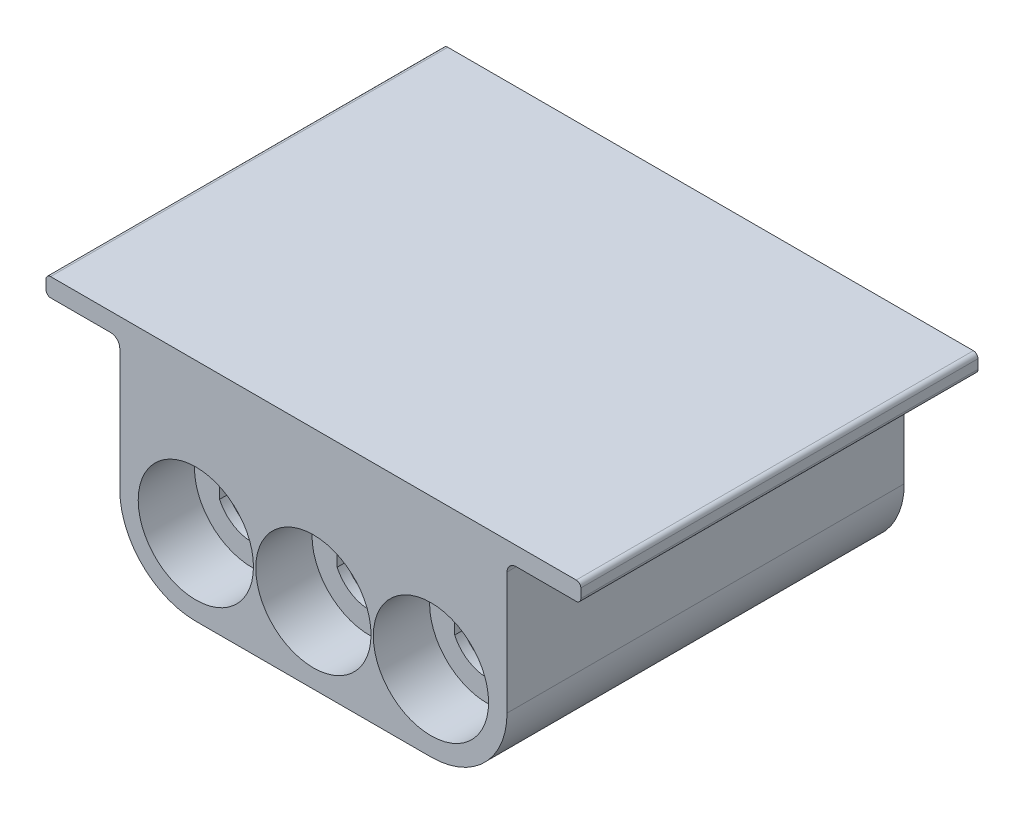
from build123d import *
from build123d.topology import SkipClean

# Parameters (mm, degrees)
SKETCH1_R            = 12.5
BOSS_EXTRUDE1_DEPTH  = 1.2
BOSS_EXTRUDE2_START  = 11
SKETCH2_R            = 12.5
BOSS_EXTRUDE2_DEPTH  = 11
BOSS_EXTRUDE3_START  = 2
BOSS_EXTRUDE3_DEPTH  = 2
SKETCH4_R            = 12
BOSS_EXTRUDE4_DEPTH  = 5.3
BOSS_EXTRUDE5_DEPTH  = 84.455
BOSS_EXTRUDE6_DEPTH  = 0.5
BOSS_EXTRUDE7_DEPTH  = 84
FILLET1_R            = 1
FILLET2_R            = 1
BOSS_EXTRUDE8_DEPTH  = 10
CHAMFER2_SIZE        = 4
SKETCH11_R           = 1.25
CUT_EXTRUDE1_DEPTH   = 20
BOSS_EXTRUDE10_DEPTH = 86.155


with BuildPart() as part:
    # Sketch1 → Boss-Extrude1 (new body)
    with BuildSketch(Plane.XY):
        with BuildLine():
            Line((-163.58008547, 21.295659048), (-163.58008547, 37.295659048))
            ThreePointArc((-163.58008547, 37.295659048), (-158.747347359, 48.962920938), (-147.08008547, 53.795659048))
            Line((-147.08008547, 53.795659048), (-96.08008547, 53.795659048))
            ThreePointArc((-96.08008547, 53.795659048), (-84.41282358, 48.962920938), (-79.58008547, 37.295659048))
            Line((-79.58008547, 37.295659048), (-79.58008547, 21.295659048))
            ThreePointArc((-79.58008547, 21.295659048), (-84.41282358, 9.628397159), (-96.08008547, 4.795659048))
            Line((-96.08008547, 4.795659048), (-147.08008547, 4.795659048))
            ThreePointArc((-147.08008547, 4.795659048), (-158.747347359, 9.628397159), (-163.58008547, 21.295659048))
        make_face()
        with Locations((-147.08008547, 21.295659048)):
            Circle(SKETCH1_R, mode=Mode.SUBTRACT)
        with Locations((-121.58008547, 21.295659048)):
            Circle(SKETCH1_R, mode=Mode.SUBTRACT)
        with Locations((-96.08008547, 21.295659048)):
            Circle(SKETCH1_R, mode=Mode.SUBTRACT)
    extrude(amount=BOSS_EXTRUDE1_DEPTH)

    # Sketch2 → Boss-Extrude2 (add)
    with SkipClean():  # the faces are left unmerged after this step: merging them gives an invalid solid
        with BuildSketch(Plane(origin=(0, 0, 0), x_dir=(-1, 0, 0), z_dir=(0, 0, -1)).offset(BOSS_EXTRUDE2_START)):
            with BuildLine():
                ThreePointArc((135.218587212, 15.169701239), (160.43008547, 21.295659048), (135.218587212, 27.421616857))
                ThreePointArc((135.218587212, 27.421616857), (134.33008547, 26.880490101), (133.441583727, 27.421616857))
                ThreePointArc((133.441583727, 27.421616857), (121.58008547, 34.645659048), (109.718587212, 27.421616857))
                ThreePointArc((109.718587212, 27.421616857), (108.83008547, 26.880490101), (107.941583727, 27.421616857))
                ThreePointArc((107.941583727, 27.421616857), (82.73008547, 21.295659048), (107.941583727, 15.169701239))
                ThreePointArc((107.941583727, 15.169701239), (108.83008547, 15.710827995), (109.718587212, 15.169701239))
                ThreePointArc((109.718587212, 15.169701239), (121.58008547, 7.945659048), (133.441583727, 15.169701239))
                ThreePointArc((133.441583727, 15.169701239), (134.33008547, 15.710827995), (135.218587212, 15.169701239))
            make_face()
            with Locations((96.08008547, 21.295659048)):
                Circle(SKETCH2_R, mode=Mode.SUBTRACT)
            with Locations((121.58008547, 21.295659048)):
                Circle(SKETCH2_R, mode=Mode.SUBTRACT)
            with Locations((147.08008547, 21.295659048)):
                Circle(SKETCH2_R, mode=Mode.SUBTRACT)
        extrude(amount=-BOSS_EXTRUDE2_DEPTH)

    # Sketch3 → Boss-Extrude3 (add)
    # profile 1 of 4: a face of its own
    with SkipClean():  # the faces are left unmerged after this step: merging them gives an invalid solid
        with BuildSketch(Plane(origin=(0, 0, -11), x_dir=(-1, 0, 0), z_dir=(0, 0, -1)).offset(BOSS_EXTRUDE3_START)):
            with BuildLine():
                ThreePointArc((107.941583727, 27.421616857), (82.73008547, 21.295659048), (107.941583727, 15.169701239))
                ThreePointArc((107.941583727, 15.169701239), (108.83008547, 15.710827995), (109.718587212, 15.169701239))
                ThreePointArc((109.718587212, 15.169701239), (121.58008547, 7.945659048), (133.441583727, 15.169701239))
                ThreePointArc((133.441583727, 15.169701239), (134.33008547, 15.710827995), (135.218587212, 15.169701239))
                ThreePointArc((135.218587212, 15.169701239), (160.43008547, 21.295659048), (135.218587212, 27.421616857))
                ThreePointArc((135.218587212, 27.421616857), (134.33008547, 26.880490101), (133.441583727, 27.421616857))
                ThreePointArc((133.441583727, 27.421616857), (121.58008547, 34.645659048), (109.718587212, 27.421616857))
                ThreePointArc((109.718587212, 27.421616857), (108.83008547, 26.880490101), (107.941583727, 27.421616857))
            make_face()
            with BuildLine():
                Line((128.63008547, 18.07696366), (128.63008547, 24.514354436))
                ThreePointArc((128.63008547, 24.514354436), (121.58008547, 29.045659048), (114.53008547, 24.514354436))
                Line((114.53008547, 24.514354436), (114.53008547, 18.07696366))
                ThreePointArc((114.53008547, 18.07696366), (121.58008547, 13.545659048), (128.63008547, 18.07696366))
            make_face(mode=Mode.SUBTRACT)
            with BuildLine():
                Line((103.13008547, 18.07696366), (103.13008547, 24.514354436))
                ThreePointArc((103.13008547, 24.514354436), (96.08008547, 29.045659048), (89.03008547, 24.514354436))
                Line((89.03008547, 24.514354436), (89.03008547, 18.07696366))
                ThreePointArc((89.03008547, 18.07696366), (96.08008547, 13.545659048), (103.13008547, 18.07696366))
            make_face(mode=Mode.SUBTRACT)
            with BuildLine():
                Line((154.13008547, 24.514354436), (154.13008547, 18.07696366))
                ThreePointArc((154.13008547, 18.07696366), (147.08008547, 13.545659048), (140.03008547, 18.07696366))
                Line((140.03008547, 18.07696366), (140.03008547, 24.514354436))
                ThreePointArc((140.03008547, 24.514354436), (147.08008547, 29.045659048), (154.13008547, 24.514354436))
            make_face(mode=Mode.SUBTRACT)
        # profile 2 of 4: a face of its own
        with BuildSketch(Plane(origin=(0, 0, -11), x_dir=(-1, 0, 0), z_dir=(0, 0, -1)).offset(BOSS_EXTRUDE3_START)):
            with BuildLine():
                Line((140.33008547, 24.448435602), (140.33008547, 18.142882494))
                ThreePointArc((140.33008547, 18.142882494), (147.08008547, 13.845659048), (153.83008547, 18.142882494))
                Line((153.83008547, 18.142882494), (153.83008547, 24.448435602))
                ThreePointArc((153.83008547, 24.448435602), (147.08008547, 28.745659048), (140.33008547, 24.448435602))
            make_face()
        # profile 3 of 4: a face of its own
        with BuildSketch(Plane(origin=(0, 0, -11), x_dir=(-1, 0, 0), z_dir=(0, 0, -1)).offset(BOSS_EXTRUDE3_START)):
            with BuildLine():
                Line((128.33008547, 18.142882494), (128.33008547, 24.448435602))
                ThreePointArc((128.33008547, 24.448435602), (121.58008547, 28.745659048), (114.83008547, 24.448435602))
                Line((114.83008547, 24.448435602), (114.83008547, 18.142882494))
                ThreePointArc((114.83008547, 18.142882494), (121.58008547, 13.845659048), (128.33008547, 18.142882494))
            make_face()
        # profile 4 of 4: a face of its own
        with BuildSketch(Plane(origin=(0, 0, -11), x_dir=(-1, 0, 0), z_dir=(0, 0, -1)).offset(BOSS_EXTRUDE3_START)):
            with BuildLine():
                Line((89.33008547, 18.142882494), (89.33008547, 24.448435602))
                ThreePointArc((89.33008547, 24.448435602), (96.08008547, 28.745659048), (102.83008547, 24.448435602))
                Line((102.83008547, 24.448435602), (102.83008547, 18.142882494))
                ThreePointArc((102.83008547, 18.142882494), (96.08008547, 13.845659048), (89.33008547, 18.142882494))
            make_face()
        extrude(amount=-BOSS_EXTRUDE3_DEPTH)


with BuildPart() as boss_extrude3_kept_piece:
    # of the separate pieces the step leaves, the one the design keeps (boss_extrude3_pieces_kept)
    add(part.part.solids().sort_by_distance((-96.08008547, 53.795659048, 0))[0])

    # Sketch4 → Boss-Extrude4 (add)
    # profile 1 of 3: a face of its own
    with SkipClean():  # the faces are left unmerged after this step: merging them gives an invalid solid
        with BuildSketch(Plane(origin=(0, 0, -13), x_dir=(-1, 0, 0), z_dir=(0, 0, -1))):
            with Locations(Location((96.08008547, 21.295659048, 0), (0, 0, 180))):
                Circle(SKETCH4_R)
            Polygon((86.78008547, 15.926301545), (96.08008547, 10.556944041), (105.38008547, 15.926301545), (105.38008547, 26.665016552), (96.08008547, 32.034374055), (86.78008547, 26.665016552), align=None, mode=Mode.SUBTRACT)
        # profile 2 of 3: a face of its own
        with BuildSketch(Plane(origin=(0, 0, -13), x_dir=(-1, 0, 0), z_dir=(0, 0, -1))):
            with Locations(Location((121.58008547, 21.295659048, 0), (0, 0, 180))):
                Circle(SKETCH4_R)
            Polygon((112.28008547, 15.926301545), (121.58008547, 10.556944041), (130.88008547, 15.926301545), (130.88008547, 26.665016552), (121.58008547, 32.034374055), (112.28008547, 26.665016552), align=None, mode=Mode.SUBTRACT)
        # profile 3 of 3: a face of its own
        with BuildSketch(Plane(origin=(0, 0, -13), x_dir=(-1, 0, 0), z_dir=(0, 0, -1))):
            with Locations(Location((147.08008547, 21.295659048, 0), (0, 0, 180))):
                Circle(SKETCH4_R)
            Polygon((137.78008547, 15.926301545), (147.08008547, 10.556944041), (156.38008547, 15.926301545), (156.38008547, 26.665016552), (147.08008547, 32.034374055), (137.78008547, 26.665016552), align=None, mode=Mode.SUBTRACT)
        extrude(amount=BOSS_EXTRUDE4_DEPTH)

    # Sketch5 → Boss-Extrude5 (add)
    with SkipClean():  # the faces are left unmerged after this step: merging them gives an invalid solid
        with BuildSketch(Plane(origin=(0, 0, 0), x_dir=(-1, 0, 0), z_dir=(0, 0, -1))):
            with BuildLine():
                Line((79.58008547, 21.295659048), (79.58008547, 37.295659048))
                ThreePointArc((79.58008547, 37.295659048), (84.41282358, 48.962920938), (96.08008547, 53.795659048))
                Line((96.08008547, 53.795659048), (147.08008547, 53.795659048))
                ThreePointArc((147.08008547, 53.795659048), (158.747347359, 48.962920938), (163.58008547, 37.295659048))
                Line((163.58008547, 37.295659048), (163.58008547, 21.295659048))
                ThreePointArc((163.58008547, 21.295659048), (158.747347359, 9.628397159), (147.08008547, 4.795659048))
                Line((147.08008547, 4.795659048), (96.08008547, 4.795659048))
                ThreePointArc((96.08008547, 4.795659048), (84.41282358, 9.628397159), (79.58008547, 21.295659048))
            make_face()
            with BuildLine():
                Line((160.28008547, 37.295659048), (160.28008547, 21.295659048))
                ThreePointArc((160.28008547, 21.295659048), (156.413894981, 11.961849536), (147.08008547, 8.095659048))
                Line((147.08008547, 8.095659048), (96.08008547, 8.095659048))
                ThreePointArc((96.08008547, 8.095659048), (86.746275958, 11.961849536), (82.88008547, 21.295659048))
                Line((82.88008547, 21.295659048), (82.88008547, 37.295659048))
                ThreePointArc((82.88008547, 37.295659048), (86.746275958, 46.62946856), (96.08008547, 50.495659048))
                Line((96.08008547, 50.495659048), (147.08008547, 50.495659048))
                ThreePointArc((147.08008547, 50.495659048), (156.413894981, 46.62946856), (160.28008547, 37.295659048))
            make_face(mode=Mode.SUBTRACT)
        extrude(amount=BOSS_EXTRUDE5_DEPTH)

    # Sketch6 → Boss-Extrude6 (add)
    with SkipClean():  # the faces are left unmerged after this step: merging them gives an invalid solid
        with BuildSketch(Plane(origin=(0, 0, -84.455), x_dir=(-1, 0, 0), z_dir=(0, 0, -1))):
            with BuildLine():
                Line((147.08008547, 4.795659048), (96.08008547, 4.795659048))
                ThreePointArc((96.08008547, 4.795659048), (84.41282358, 9.628397159), (79.58008547, 21.295659048))
                Line((79.58008547, 21.295659048), (79.58008547, 37.295659048))
                ThreePointArc((79.58008547, 37.295659048), (84.41282358, 48.962920938), (96.08008547, 53.795659048))
                Line((96.08008547, 53.795659048), (147.08008547, 53.795659048))
                ThreePointArc((147.08008547, 53.795659048), (158.747347359, 48.962920938), (163.58008547, 37.295659048))
                Line((163.58008547, 37.295659048), (163.58008547, 21.295659048))
                ThreePointArc((163.58008547, 21.295659048), (158.747347359, 9.628397159), (147.08008547, 4.795659048))
            make_face()
            with BuildLine():
                Line((82.88008547, 21.295659048), (82.88008547, 37.295659048))
                ThreePointArc((82.88008547, 37.295659048), (86.746275958, 46.62946856), (96.08008547, 50.495659048))
                Line((96.08008547, 50.495659048), (147.08008547, 50.495659048))
                ThreePointArc((147.08008547, 50.495659048), (156.413894981, 46.62946856), (160.28008547, 37.295659048))
                Line((160.28008547, 37.295659048), (160.28008547, 21.295659048))
                ThreePointArc((160.28008547, 21.295659048), (156.413894981, 11.961849536), (147.08008547, 8.095659048))
                Line((147.08008547, 8.095659048), (96.08008547, 8.095659048))
                ThreePointArc((96.08008547, 8.095659048), (86.746275958, 11.961849536), (82.88008547, 21.295659048))
            make_face(mode=Mode.SUBTRACT)
        extrude(amount=BOSS_EXTRUDE6_DEPTH)

    # Sketch7 → Boss-Extrude7 (add)
    with SkipClean():  # the faces are left unmerged after this step: merging them gives an invalid solid
        with BuildSketch(Plane(origin=(0, 0, 0), x_dir=(-1, 0, 0), z_dir=(0, 0, -1))):
            with BuildLine():
                Line((150.66508547, 39.987963894), (147.96508547, 39.987963894))
                Line((147.96508547, 39.987963894), (147.96508547, 38.187963894))
                Line((147.96508547, 38.187963894), (160.249891545, 38.187963894))
                ThreePointArc((160.249891545, 38.187963894), (159.725400774, 41.081950221), (158.573125876, 43.787963894))
                Line((158.573125876, 43.787963894), (147.96508547, 43.787963894))
                Line((147.96508547, 43.787963894), (147.96508547, 41.987963894))
                Line((147.96508547, 41.987963894), (150.66508547, 41.987963894))
                Line((150.66508547, 41.987963894), (150.66508547, 39.987963894))
            make_face()
            with BuildLine():
                Line((95.18008547, 38.187963894), (95.18008547, 39.987963894))
                Line((95.18008547, 39.987963894), (92.48008547, 39.987963894))
                Line((92.48008547, 39.987963894), (92.48008547, 41.987963894))
                Line((92.48008547, 41.987963894), (95.18008547, 41.987963894))
                Line((95.18008547, 41.987963894), (95.18008547, 43.787963894))
                Line((95.18008547, 43.787963894), (84.587045063, 43.787963894))
                ThreePointArc((84.587045063, 43.787963894), (83.434770165, 41.081950221), (82.910279394, 38.187963894))
                Line((82.910279394, 38.187963894), (95.18008547, 38.187963894))
            make_face()
        extrude(amount=BOSS_EXTRUDE7_DEPTH)

    # Fillet1
    # the kernel refuses this fillet: 1 mm, written as the material it adds along each edge
    with BuildSketch(Plane(origin=(-160.249891545, 38.187963894, 0), x_dir=(-0.030180170539451462, -0.9995444749015472, 0), z_dir=(0, 0, -1))) as fillet1_piece_1:
        with BuildLine():
            CenterArc((0.970275562, -0.999544475), FILLET1_R, 88.270540991, 90)
            Line((-0.029268913, -0.969364304), (-0.12922336, -0.966346287))
            Line((-0.12922336, -0.966346287), (-0.099954447, 0.003018017))
            Line((-0.099954447, 0.003018017), (-0.003745692, 0.099929824))
            ThreePointArc((-0.003745692, 0.099929824), (0.895827653, 0.103204706), (1.00347375, 0.099954447))
            Line((1.00347375, 0.099954447), (1.000455733, 0))
        make_face()
    extrude(amount=84)
    with BuildSketch(Plane(origin=(-158.573125876, 43.787963894, 0), x_dir=(0.554480814954232, 0.8321965067504734, 0), z_dir=(0, 0, -1))) as fillet1_piece_2:
        with BuildLine():
            CenterArc((1.866124526, 0.997297467), FILLET1_R, 146.325037951, 127.888248777)
            Line((1.03392802, 1.551778282), (0, 0))
            ThreePointArc((0, 0), (0.969796998, -0.03567344), (1.939593996, 0))
        make_face()
    extrude(amount=84)
    with BuildSketch(Plane(origin=(-84.587045063, 43.787963894, 0), x_dir=(-0.5544808149542387, 0.832196506750469, 0), z_dir=(0, 0, -1))) as fillet1_piece_3:
        with BuildLine():
            CenterArc((1.866124526, -0.997297467), FILLET1_R, 85.786713272, 127.888248777)
            Line((1.03392802, -1.551778282), (0, 0))
            ThreePointArc((0, 0), (0.969796998, 0.03567344), (1.939593996, 0))
        make_face()
    extrude(amount=84)
    with BuildSketch(Plane(origin=(-82.910279394, 38.187963894, 0), x_dir=(0.030180170539437272, -0.9995444749015476, 0), z_dir=(0, 0, -1))) as fillet1_piece_4:
        with BuildLine():
            CenterArc((0.970275562, 0.999544475), FILLET1_R, 181.729459009, 90)
            Line((-0.029268913, 0.969364304), (-0.12922336, 0.966346287))
            Line((-0.12922336, 0.966346287), (-0.099954447, -0.003018017))
            Line((-0.099954447, -0.003018017), (-0.003745692, -0.099929824))
            ThreePointArc((-0.003745692, -0.099929824), (0.895827653, -0.103204706), (1.00347375, -0.099954447))
            Line((1.00347375, -0.099954447), (1.000455733, 0))
        make_face()
    extrude(amount=84)

    # Fillet2
    # the kernel refuses this fillet: 1 mm, written as the material it takes off along each edge
    with BuildSketch(Plane(origin=(-95.18008547, 43.787963894, 0), x_dir=(0, -1, 0), z_dir=(0, 0, -1)), Plane(origin=(-95.18008547, 41.987963894, 0), x_dir=(1, 0, 0), z_dir=(0, 0, -1)), Plane(origin=(-95.18008547, 39.987963894, 0), x_dir=(0, -1, 0), z_dir=(0, 0, -1)), Plane(origin=(-147.96508547, 43.787963894, 0), x_dir=(-1, 0, 0), z_dir=(0, 0, -1)), Plane(origin=(-147.96508547, 41.987963894, 0), x_dir=(0, 1, 0), z_dir=(0, 0, -1)), Plane(origin=(-147.96508547, 39.987963894, 0), x_dir=(-1, 0, 0), z_dir=(0, 0, -1)), Plane(origin=(-147.96508547, 38.187963894, 0), x_dir=(0, 1, 0), z_dir=(0, 0, -1))) as fillet2_piece_1:
        with BuildLine():
            CenterArc((FILLET2_R, -FILLET2_R), FILLET2_R, 90, 90)
            Line((0, -FILLET2_R), (0, 0))
            Line((0, 0), (FILLET2_R, 0))
        make_face()
    extrude(amount=86.5, mode=Mode.SUBTRACT)
    with BuildSketch(Plane(origin=(-95.18008547, 38.187963894, 0), x_dir=(0, 1, 0), z_dir=(0, 0, -1))) as fillet2_piece_2:
        with BuildLine():
            CenterArc((FILLET2_R, FILLET2_R), FILLET2_R, 180, 90)
            Line((0, FILLET2_R), (0, 0))
            Line((0, 0), (FILLET2_R, 0))
        make_face()
    extrude(amount=86.5, mode=Mode.SUBTRACT)

    # Sketch10 → Boss-Extrude8 (add)
    with BuildSketch(Plane(origin=(0, 0, -84.955), x_dir=(-1, 0, 0), z_dir=(0, 0, -1))):
        with BuildLine():
            Line((82.88008547, 21.295659048), (96.08008547, 8.095659048))
            ThreePointArc((96.08008547, 8.095659048), (86.746275958, 11.961849536), (82.88008547, 21.295659048))
        make_face()
        with BuildLine():
            Line((160.28008547, 21.295659048), (147.08008547, 8.095659048))
            ThreePointArc((147.08008547, 8.095659048), (156.413894981, 11.961849536), (160.28008547, 21.295659048))
        make_face()
    extrude(amount=-BOSS_EXTRUDE8_DEPTH)

    # Chamfer2
    # the kernel refuses this chamfer: 4 mm, written as the material it takes off along each edge
    with BuildSketch(Plane(origin=(-167.553903389, 28.569476968, -74.955), x_dir=(0, 0, -1), z_dir=(0.7071067811865477, -0.7071067811865474, 0))) as chamfer2_piece_1_section:
        Polygon((CHAMFER2_SIZE, 0), (0, -CHAMFER2_SIZE), (0, 0), align=None)
    chamfer2_piece_1 = extrude(amount=39.241082927, mode=Mode.PRIVATE)
    chamfer2_piece_1 = chamfer2_piece_1 & Plane(origin=(-147.08008547, 21.295659048, -74.955), x_dir=(-1, 0, 0), z_dir=(0, 0, 1)) * Cylinder(13.2, 95, mode=Mode.PRIVATE)
    add(chamfer2_piece_1, mode=Mode.SUBTRACT)
    with BuildSketch(Plane(origin=(-75.60626755, 28.569476968, -74.955), x_dir=(0, 0, -1), z_dir=(-0.7071067811865475, -0.7071067811865476, 0))) as chamfer2_piece_2_section:
        Polygon((CHAMFER2_SIZE, 0), (0, CHAMFER2_SIZE), (0, 0), align=None)
    chamfer2_piece_2 = extrude(amount=39.241082927, mode=Mode.PRIVATE)
    chamfer2_piece_2 = chamfer2_piece_2 & Plane(origin=(-96.08008547, 21.295659048, -74.955), x_dir=(0, -1, 0), z_dir=(0, 0, 1)) * Cylinder(13.2, 95, mode=Mode.PRIVATE)
    add(chamfer2_piece_2, mode=Mode.SUBTRACT)

    # Sketch11 → Cut-Extrude1 (cut)
    with BuildSketch(Plane(origin=(0, 0, -84.955), x_dir=(-1, 0, 0), z_dir=(0, 0, -1))):
        with Locations((89.03008547, 40.987963894)):
            Circle(SKETCH11_R)
        with Locations((86.946454525, 12.162028103)):
            Circle(SKETCH11_R)
        with Locations((156.213716414, 12.162028103)):
            Circle(SKETCH11_R)
        with Locations((154.12258547, 40.987963894)):
            Circle(SKETCH11_R)
    extrude(amount=-CUT_EXTRUDE1_DEPTH, mode=Mode.SUBTRACT)

    # Sketch13 → Boss-Extrude10 (add)
    with BuildSketch(Plane.XY.offset(1.2)):
        with BuildLine():
            Line((-96.08008547, 53.795659048), (-72.08008547, 53.795659048))
            Line((-72.08008547, 53.795659048), (-64.58008547, 53.795659048))
            ThreePointArc((-64.58008547, 53.795659048), (-63.872978688, 53.502765829), (-63.58008547, 52.795659048))
            Line((-63.58008547, 52.795659048), (-63.58008547, 50.795659048))
            ThreePointArc((-63.58008547, 50.795659048), (-63.872978688, 50.088552267), (-64.58008547, 49.795659048))
            Line((-64.58008547, 49.795659048), (-77.58008547, 49.795659048))
            ThreePointArc((-77.58008547, 49.795659048), (-78.994299032, 49.209872611), (-79.58008547, 47.795659048))
            Line((-79.58008547, 47.795659048), (-79.58008547, 37.295659048))
            ThreePointArc((-79.58008547, 37.295659048), (-84.41282358, 48.962920938), (-96.08008547, 53.795659048))
        make_face()
        with BuildLine():
            Line((-163.58008547, 37.295659048), (-163.58008547, 47.795659048))
            ThreePointArc((-163.58008547, 47.795659048), (-164.165871907, 49.209872611), (-165.58008547, 49.795659048))
            Line((-165.58008547, 49.795659048), (-178.58008547, 49.795659048))
            ThreePointArc((-178.58008547, 49.795659048), (-179.287192251, 50.088552267), (-179.58008547, 50.795659048))
            Line((-179.58008547, 50.795659048), (-179.58008547, 52.795659048))
            ThreePointArc((-179.58008547, 52.795659048), (-179.287192251, 53.502765829), (-178.58008547, 53.795659048))
            Line((-178.58008547, 53.795659048), (-147.08008547, 53.795659048))
            ThreePointArc((-147.08008547, 53.795659048), (-158.747347359, 48.962920938), (-163.58008547, 37.295659048))
        make_face()
    extrude(amount=-BOSS_EXTRUDE10_DEPTH)


solid = boss_extrude3_kept_piece.part
